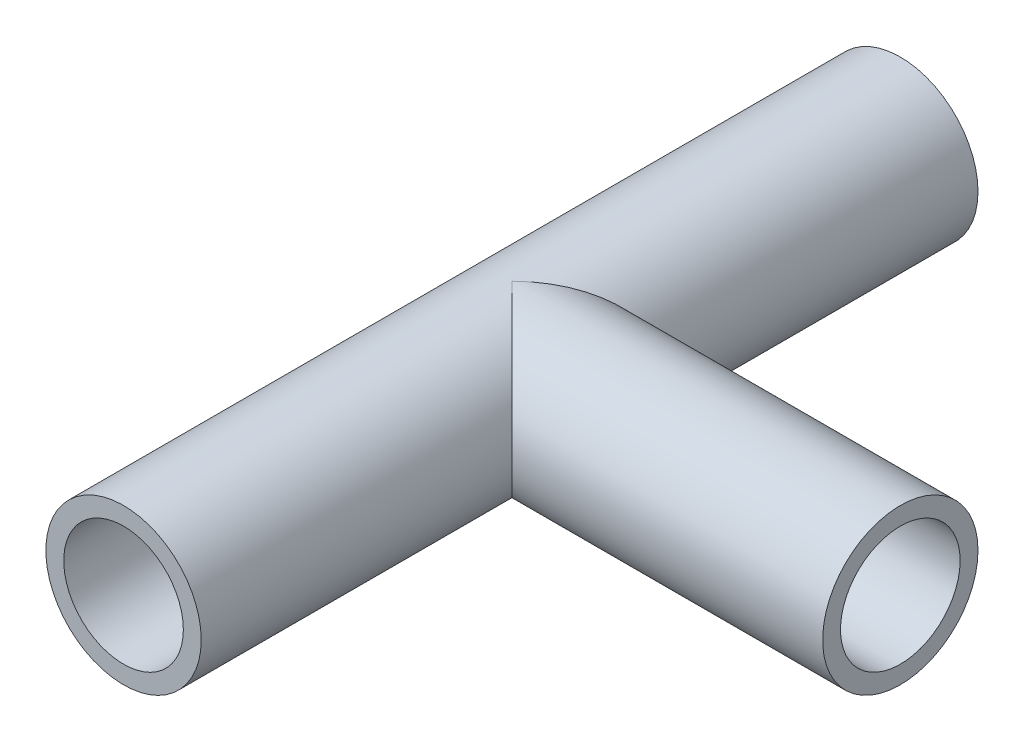
from build123d import *

# Parameters (mm, degrees)
SKETCH12_R          = 10
BOSS_EXTRUDE2_DEPTH = 100
SKETCH13_R          = 10
BOSS_EXTRUDE3_DEPTH = 50
SHELL7_OUTLINE_R    = 7.7
SHELL7_DEPTH        = 100
SHELL7_START        = -1e-07
SHELL7_2_OUTLINE_R  = 7.7
SHELL7_2_DEPTH      = 50.0000001


with BuildPart() as part:
    # Sketch12 → Boss-Extrude2 (new body)
    with BuildSketch(Plane.XY):
        with Locations(Location((0, 0, 0), (0, 0, 180))):
            Circle(SKETCH12_R)
    extrude(amount=BOSS_EXTRUDE2_DEPTH)

    # Sketch13 → Boss-Extrude3 (add)
    with BuildSketch(Plane(origin=(0, 0, 0), x_dir=(0, 0, -1), z_dir=(1, 0, 0))):
        with Locations((-50, 0)):
            Circle(SKETCH13_R)
    extrude(amount=BOSS_EXTRUDE3_DEPTH)

    # Shell7: read off the stored shape, not the designer's step
    # Shell7 outline → Shell7 (cut)
    with BuildSketch(Plane.XY):
        Circle(SHELL7_OUTLINE_R)
    extrude(amount=SHELL7_DEPTH, mode=Mode.SUBTRACT)

    # Shell7 2 outline → Shell7 2 (cut)
    with BuildSketch(Plane.YZ.offset(SHELL7_START)):
        with Locations((0, 50)):
            Circle(SHELL7_2_OUTLINE_R)
    extrude(amount=SHELL7_2_DEPTH, mode=Mode.SUBTRACT)


solid = part.part
